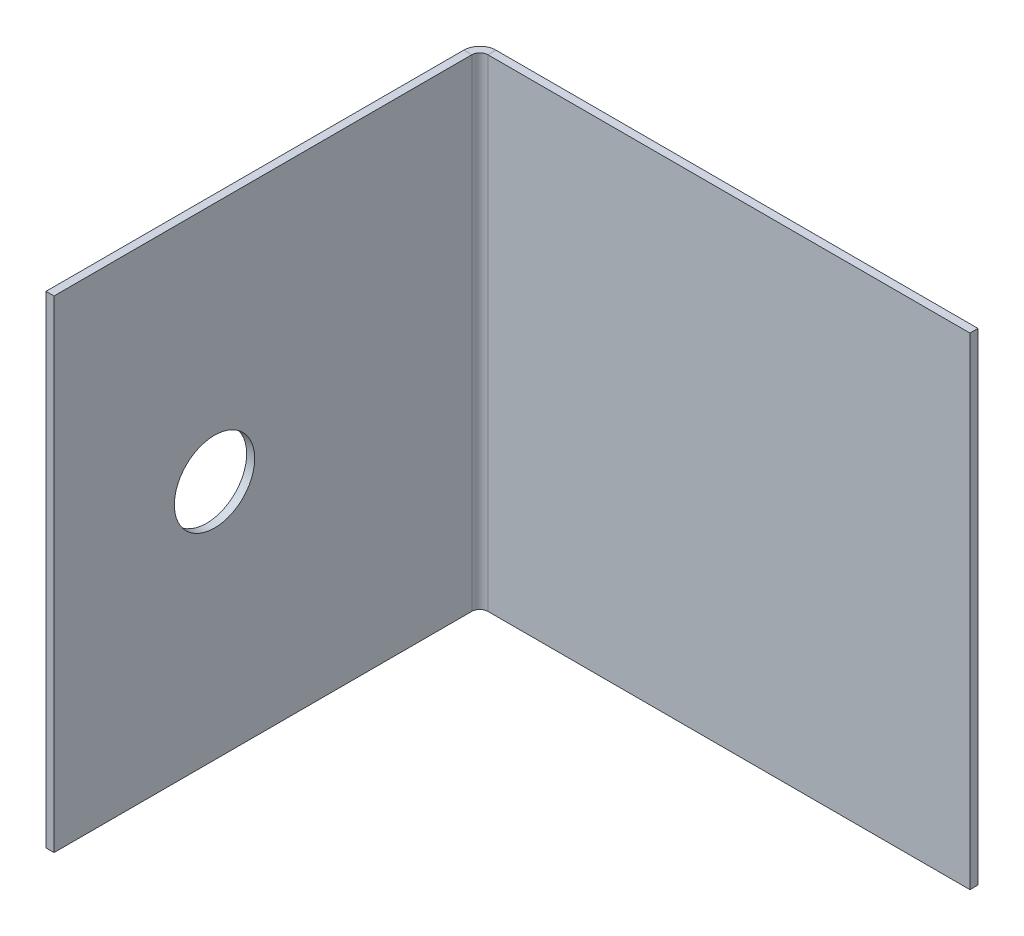
from build123d import *

# Parameters (mm, degrees)
SKETCH_1_W             = 30
SKETCH_1_H             = 30
SM_BASE_FLANGE_1_DEPTH = 0.5
SM_EDGE_FLANGE_1_DEPTH = 30
HOLE_WIZARD_M6_1_D     = 5
HOLE_WIZARD_M6_1_DEPTH = 15
HOLE_WIZARD_M6_1_TIP   = 1.502151548


# Sheet-metal steps are written as plain solids
with BuildPart() as part:
    # Sketch 1 → 基体-法兰1 (new body)
    with BuildSketch(Plane.XY):
        Rectangle(SKETCH_1_W, SKETCH_1_H)
    extrude(amount=-SM_BASE_FLANGE_1_DEPTH)

    # 边线-法兰1 section (across the edge) → 边线-法兰1 (add)
    with BuildSketch(Plane(origin=(-15.5, 15, 0), x_dir=(1, 0, 0), z_dir=(0, -1, 0))):
        with BuildLine():
            Line((-0.5, 0.5), (-0.5, 26.5))
            Line((-0.5, 26.5), (0, 26.5))
            Line((0, 26.5), (0, 0.5))
            ThreePointArc((0, 0.5), (0.146446609, 0.146446609), (0.5, 0))
            Line((0.5, 0), (0.5, -0.5))
            ThreePointArc((0.5, -0.5), (-0.207106781, -0.207106781), (-0.5, 0.5))
        make_face()
    extrude(amount=SM_EDGE_FLANGE_1_DEPTH)

    # M6 螺纹孔的螺纹孔钻头1
    with Locations(Plane(origin=(-15.5, 0, 16.512507822), x_dir=(0, 0, 1), z_dir=(1, 0, 0))):
        with Locations((0, 0)):
            Hole(HOLE_WIZARD_M6_1_D / 2, depth=HOLE_WIZARD_M6_1_DEPTH)
            with Locations((0, 0, -(HOLE_WIZARD_M6_1_DEPTH + HOLE_WIZARD_M6_1_TIP / 2))):  # 118° drill point
                Cone(0, HOLE_WIZARD_M6_1_D / 2, HOLE_WIZARD_M6_1_TIP, mode=Mode.SUBTRACT)


solid = part.part
